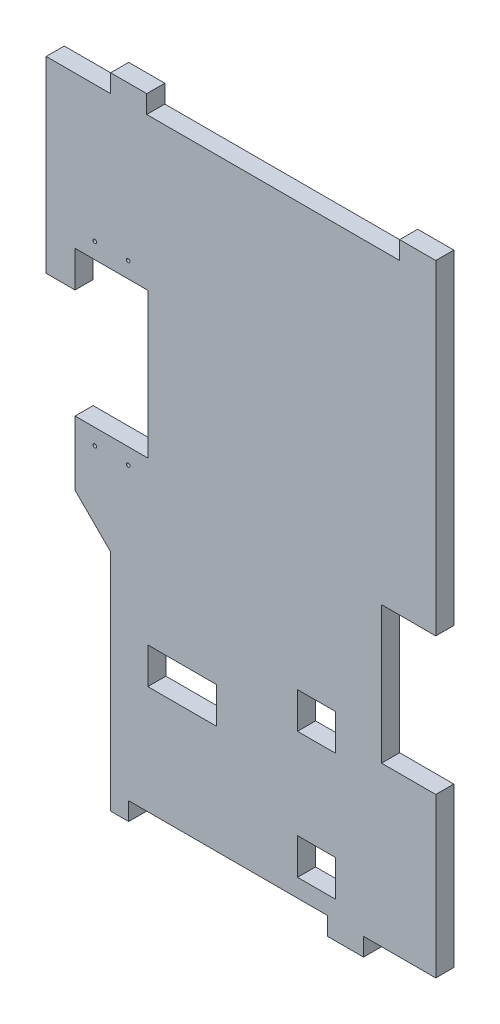
from build123d import *

# Parameters (mm, degrees)
ESQUISSE1_W             = 10.465871206
ESQUISSE1_H             = 10
ESQUISSE1_W_2           = 19.015615649
BOSS_EXTRU_1_DEPTH      = 5
BOSS_EXTRU_2_DEPTH      = 5
ESQUISSE3_R             = 0.5
ESQUISSE3_W             = 20.2
ESQUISSE3_H             = 40.2
ENL_V_MAT_EXTRU_1_DEPTH = 5
BOSS_EXTRU_3_DEPTH      = 5


with BuildPart() as part:
    # Esquisse1 → Boss.-Extru.1 (new body)
    with BuildSketch(Plane.XY):
        Polygon((90, 82), (90, 167), (90, 172), (80, 172), (80, 167), (10, 167), (10, 172), (0, 172), (0, 167), (0, 0), (0, -5), (5, -5), (5, 0), (60, 0), (60, -5), (70, -5), (70, 0), (90, 0), (90, 44), (75, 44), (75, 82), align=None)
        with Locations((56.967345119, 45)):
            Rectangle(ESQUISSE1_W, ESQUISSE1_H, mode=Mode.SUBTRACT)
        with Locations((56.967345119, 10)):
            Rectangle(ESQUISSE1_W, ESQUISSE1_H, mode=Mode.SUBTRACT)
        with Locations((19.799482129, 35)):
            Rectangle(ESQUISSE1_W_2, ESQUISSE1_H, mode=Mode.SUBTRACT)
    extrude(amount=BOSS_EXTRU_1_DEPTH)

    # Esquisse2 → Boss.-Extru.2 (add)
    with BuildSketch(Plane.XY.offset(5)):
        Polygon((0, 167), (-9.834708684, 167), (-9.834708684, 67), (0, 57.165291316), align=None)
    extrude(amount=-BOSS_EXTRU_2_DEPTH)

    # Esquisse3 → Enlèv. mat.-Extru.1 (cut)
    with BuildSketch(Plane(origin=(0, 0, 0), x_dir=(-1, 0, 0), z_dir=(0, 0, -1))):
        with Locations((4.359708684, 129.4)):
            Circle(ESQUISSE3_R)
        with Locations((-4.890291316, 129.4)):
            Circle(ESQUISSE3_R)
        with Locations((4.359708684, 80.4)):
            Circle(ESQUISSE3_R)
        with Locations((-4.890291316, 80.4)):
            Circle(ESQUISSE3_R)
        with Locations((-0.265291316, 104.9)):
            Rectangle(ESQUISSE3_W, ESQUISSE3_H)
    extrude(amount=-ENL_V_MAT_EXTRU_1_DEPTH, mode=Mode.SUBTRACT)

    # Esquisse4 → Boss.-Extru.3 (add)
    with BuildSketch(Plane.XY.offset(5)):
        Polygon((-9.834708684, 167), (-17.834708684, 167), (-17.834708684, 115), (-9.834708684, 115), (-9.834708684, 125), align=None)
    extrude(amount=-BOSS_EXTRU_3_DEPTH)


solid = part.part
